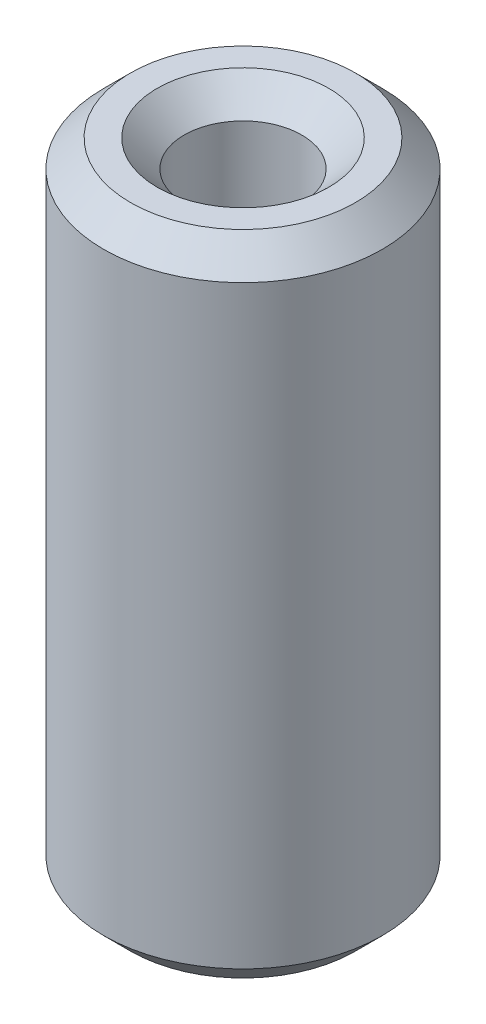
from build123d import *

# Parameters (mm, degrees)
SKETCH1_R           = 7.5
BOSS_EXTRUDE1_DEPTH = 34.886664616
SKETCH2_R           = 3.165043877
CUT_EXTRUDE1_DEPTH  = 37.463397648
CHAMFER1_SIZE       = 1.451437598


with BuildPart() as part:
    # Sketch1 → Boss-Extrude1 (new body)
    with BuildSketch(Plane(origin=(0, 0, 0), x_dir=(1, 0, 0), z_dir=(0, 1, 0))):
        Circle(SKETCH1_R)
    extrude(amount=BOSS_EXTRUDE1_DEPTH)

    # Sketch2 → Cut-Extrude1 (cut, through all)
    with BuildSketch(Plane(origin=(0, 0, 0), x_dir=(1, 0, 0), z_dir=(0, 1, 0))):
        Circle(SKETCH2_R)
    extrude(amount=CUT_EXTRUDE1_DEPTH, mode=Mode.SUBTRACT)

    # Chamfer1
    chamfer1_edges = [part.edges().sort_by_distance(p)[0] for p in [
        (-3.165043877, 34.886664616, 0),
        (-3.165043877, 0, 0),
        (-7.5, 0, 0),
        (-7.5, 34.886664616, 0),
    ]]
    chamfer(chamfer1_edges, length=CHAMFER1_SIZE)


solid = part.part
